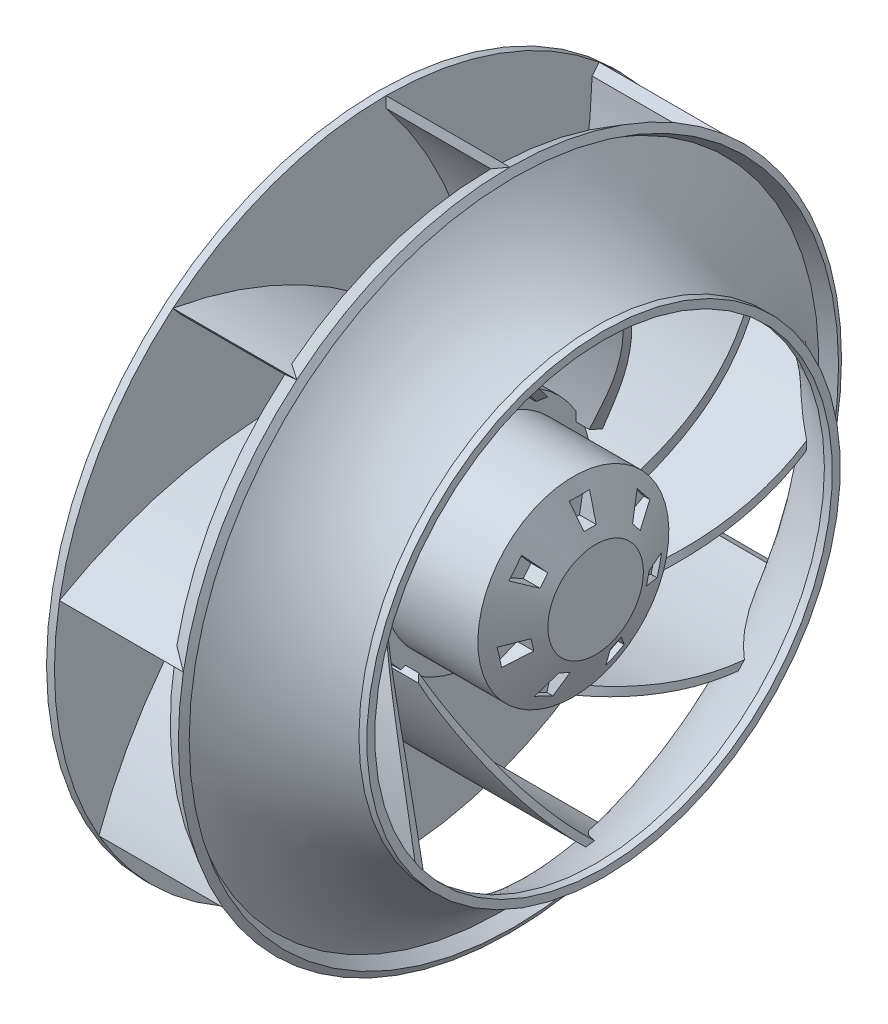
from build123d import *

# Parameters (mm, degrees)
SKETCH4_W                       = 3
SKETCH4_H                       = 125
SKETCH7_W                       = 5
SKETCH7_H                       = 37.5
BLADE_DEPTH                     = 82
PATTERN_BLADE_COUNT             = 9
CUT_BODY_INNER_DEPTH            = 198.293923528
PATTERN_CUT_BODY_INNER_COUNT    = 7
SKETCH17_R                      = 2
FIXING_HOLE_DEPTH               = 198.468985033
PATTERN_FIXING_HOLE_COUNT       = 4
SKETCH22_R                      = 3
FIXING_HOLE_OUTER_DEPTH         = 196.719186719
PATTERN_FIXING_HOLE_OUTER_COUNT = 4
SKETCH21_W                      = 3
SKETCH21_H                      = 6.753893087
SCALE1_SCALE                    = 1.24
SKETCH28_W                      = 6.2
SKETCH28_H                      = 30
BOSS_EXTRUDE1_DEPTH             = 69
SKETCH30_R                      = 71.472256999
SKETCH30_R_2                    = 60.472256999
CUT_EXTRUDE1_DEPTH              = 7
SKETCH31_R                      = 4.5
SKETCH31_R_2                    = 3
BOSS_EXTRUDE2_DEPTH             = 69


with BuildPart() as part:
    # Sketch4 → Body-Plate (revolve)
    with BuildSketch(Plane.XY):
        with Locations((1.5, 62.5)):
            Rectangle(SKETCH4_W, SKETCH4_H)
    revolve(axis=Axis((3, 0, 0), (-1, 0, 0)))

    # Sketch5 → Body-Inner (revolve)
    with BuildSketch(Plane.XY, mode=Mode.PRIVATE) as body_inner_sk:
        Polygon((82, 18), (82, 0), (3, 0), (3, 42.224912145), (38.303231077, 42.224912145), (38.303231077, 36), (73.606462153, 36), align=None)
    revolve(body_inner_sk.sketch.rotate(Axis((3, 0, 0), (1, 0, 0)), 180), axis=Axis((3, 0, 0), (1, 0, 0)))

    # Sketch6 → Body-Motor (revolve)
    with BuildSketch(Plane.XY, mode=Mode.PRIVATE) as body_motor_sk:
        Polygon((-9, 48.767949192), (-9, 0), (0, 0), (0, 50.5), (-3, 48.767949192), align=None)
    revolve(body_motor_sk.sketch.rotate(Axis((-14, 0, 0), (1, 0, 0)), 180), axis=Axis((-14, 0, 0), (1, 0, 0)))

    # Sketch7 → Contact (revolve)
    with BuildSketch(Plane.XY, mode=Mode.PRIVATE) as contact_sk:
        with Locations((-11.5, 18.75)):
            Rectangle(SKETCH7_W, SKETCH7_H)
    revolve(contact_sk.sketch.rotate(Axis((-14, 0, 0), (1, 0, 0)), 180), axis=Axis((-14, 0, 0), (1, 0, 0)))

    # Sketch9 → Blade (add)
    with BuildSketch(Plane(origin=(0, 0, 0), x_dir=(0, 0, -1), z_dir=(1, 0, 0))):
        with BuildLine():
            Line((0, 125), (0, 120.848382707))
            ThreePointArc((0, 120.848382707), (26.963880497, 72.534378727), (36.307079572, 18))
            Line((36.307079572, 18), (38.944815066, 18))
            ThreePointArc((38.944815066, 18), (28.905901001, 74.933510827), (0, 125))
        make_face()
    blade = extrude(amount=BLADE_DEPTH)

    # Pattern-Blade: Blade ×9 about axis
    pattern_blade_axis = Axis((0, 0, 0), (1, 0, 0))
    for i in range(1, PATTERN_BLADE_COUNT):
        add(blade.rotate(pattern_blade_axis, i * 360 / PATTERN_BLADE_COUNT))

    # Sketch8 → Body-Outer (revolve)
    with BuildSketch(Plane.XY, mode=Mode.PRIVATE) as body_outer_sk:
        with BuildLine():
            Line((49.690812085, 125), (42.5, 120.848382707))
            ThreePointArc((42.5, 120.848382707), (59.388524533, 100.282325329), (82, 86.25))
            Line((82, 86.25), (85, 86.25))
            Line((85, 86.25), (85, 89.25))
            Line((85, 89.25), (82, 89.25))
            ThreePointArc((82, 89.25), (61.91182214, 101.754721641), (46.443798002, 119.66123393))
            Line((46.443798002, 119.66123393), (51.190812085, 122.401923789))
            Line((51.190812085, 122.401923789), (49.690812085, 125))
        make_face()
    revolve(body_outer_sk.sketch.rotate(Axis((3, 0, 0), (1, 0, 0)), 180), axis=Axis((3, 0, 0), (1, 0, 0)))

    # Sketch11 → Cut-Blade (revolve, cut)
    with BuildSketch(Plane.XY, mode=Mode.PRIVATE) as cut_blade_sk:
        with BuildLine():
            Line((82, 89.25), (82, 125))
            Line((82, 125), (49.690812085, 125))
            Line((49.690812085, 125), (51.190812085, 122.401923789))
            Line((51.190812085, 122.401923789), (46.443798002, 119.66123393))
            ThreePointArc((46.443798002, 119.66123393), (61.91182214, 101.754721641), (82, 89.25))
        make_face()
        with BuildLine():
            Line((82, 86.25), (82, 18))
            Line((82, 18), (73.606462153, 36))
            Line((73.606462153, 36), (38.303231077, 36))
            ThreePointArc((38.303231077, 36), (58.949620899, 61.963121366), (67.545265875, 94.001722634))
            ThreePointArc((67.545265875, 94.001722634), (74.577212745, 89.761458842), (82, 86.25))
        make_face()
    revolve(cut_blade_sk.sketch.rotate(Axis((3, 0, 0), (1, 0, 0)), 180), axis=Axis((3, 0, 0), (1, 0, 0)), mode=Mode.SUBTRACT)

    # Sketch13 → Cut-Body-Inner (cut, through all)
    with BuildSketch(Plane(origin=(73.606462153, 0, 0), x_dir=(0, 0, -1), z_dir=(1, 0, 0))):
        Polygon((3.836511649, 30.932858572), (-3.836511649, 30.932858572), (-2.313853995, 22.297437901), (2.313853995, 22.297437901), align=None)
    cut_body_inner = extrude(amount=CUT_BODY_INNER_DEPTH, mode=Mode.SUBTRACT)

    # Pattern-Cut-Body-Inner: Cut-Body-Inner ×7 about axis
    pattern_cut_body_inner_axis = Axis((0, 0, 0), (1, 0, 0))
    for i in range(1, PATTERN_CUT_BODY_INNER_COUNT):
        add(cut_body_inner.rotate(pattern_cut_body_inner_axis, i * 360 / PATTERN_CUT_BODY_INNER_COUNT), mode=Mode.SUBTRACT)

    # Sketch17 → Fixing-Hole (cut, through all)
    with BuildSketch(Plane(origin=(-3, 0, 0), x_dir=(0, 0, -1), z_dir=(1, 0, 0))):
        with Locations((0, 29)):
            Circle(SKETCH17_R)
    fixing_hole = extrude(amount=-FIXING_HOLE_DEPTH, mode=Mode.SUBTRACT)

    # Pattern-Fixing-Hole: Fixing-Hole ×4 about axis
    pattern_fixing_hole_axis = Axis((0, 0, 0), (1, 0, 0))
    for i in range(1, PATTERN_FIXING_HOLE_COUNT):
        add(fixing_hole.rotate(pattern_fixing_hole_axis, i * 360 / PATTERN_FIXING_HOLE_COUNT), mode=Mode.SUBTRACT)

    # Sketch22 → Fixing-Hole-Outer (cut, through all)
    with BuildSketch(Plane(origin=(1, 0, 0), x_dir=(0, 0, -1), z_dir=(1, 0, 0))):
        with Locations((0, 45)):
            Circle(SKETCH22_R)
    fixing_hole_outer = extrude(amount=-FIXING_HOLE_OUTER_DEPTH, mode=Mode.SUBTRACT)

    # Pattern-Fixing-Hole-Outer: Fixing-Hole-Outer ×4 about axis
    pattern_fixing_hole_outer_axis = Axis((0, 0, 0), (1, 0, 0))
    for i in range(1, PATTERN_FIXING_HOLE_OUTER_COUNT):
        add(fixing_hole_outer.rotate(pattern_fixing_hole_outer_axis, i * 360 / PATTERN_FIXING_HOLE_OUTER_COUNT), mode=Mode.SUBTRACT)

    # Sketch21 → Cut-Body (revolve, cut)
    with BuildSketch(Plane.XY, mode=Mode.PRIVATE) as cut_body_sk:
        with Locations((1.5, 53.876946543)):
            Rectangle(SKETCH21_W, SKETCH21_H)
    revolve(cut_body_sk.sketch.rotate(Axis((-14, 0, 0), (1, 0, 0)), 180), axis=Axis((-14, 0, 0), (1, 0, 0)), mode=Mode.SUBTRACT)


with BuildPart() as part_1:
    # Scale1: scaled about (28.677409491, 3.74e-07, -1.18e-07)
    add(part.part.scale(SCALE1_SCALE).moved(Location((-6.882578278, -9e-08, 2.8e-08))))


with BuildPart() as boss_extrude1_tool:
    # Sketch28 → Boss-Extrude1 (new body)
    with BuildSketch(Plane(origin=(0, 0, 0), x_dir=(1, 0, 0), z_dir=(0, 1, 0))):
        with Locations((-21.142585849, 0)):
            Rectangle(SKETCH28_W, SKETCH28_H)
    extrude(amount=BOSS_EXTRUDE1_DEPTH)


with BuildPart() as part_2:
    add(part_1.part)


with BuildPart() as part_3:
    # Boss-Extrude1: joined with boss_extrude1_tool
    add(part_2.part.fuse(boss_extrude1_tool.part, tol=0.00001))

    # Sketch30 → Cut-Extrude1 (cut)
    with BuildSketch(Plane.ZY.offset(24.242585849)):
        Circle(SKETCH30_R)
        with Locations(Location((0, 0, 0), (0, 0, 270))):
            Circle(SKETCH30_R_2, mode=Mode.SUBTRACT)
    extrude(amount=-CUT_EXTRUDE1_DEPTH, mode=Mode.SUBTRACT)

    # Sketch31 → Boss-Extrude2 (add)
    with BuildSketch(Plane(origin=(0, 0, 0), x_dir=(1, 0, 0), z_dir=(0, 1, 0))):
        with Locations(Location((-17.422585849, 7.022081348, 0), (0, 0, 90))):
            Circle(SKETCH31_R)
        with Locations(Location((-17.422585849, -6.757067669, 0), (0, 0, 90))):
            Circle(SKETCH31_R_2)
    extrude(amount=BOSS_EXTRUDE2_DEPTH)


solid = part_3.part
